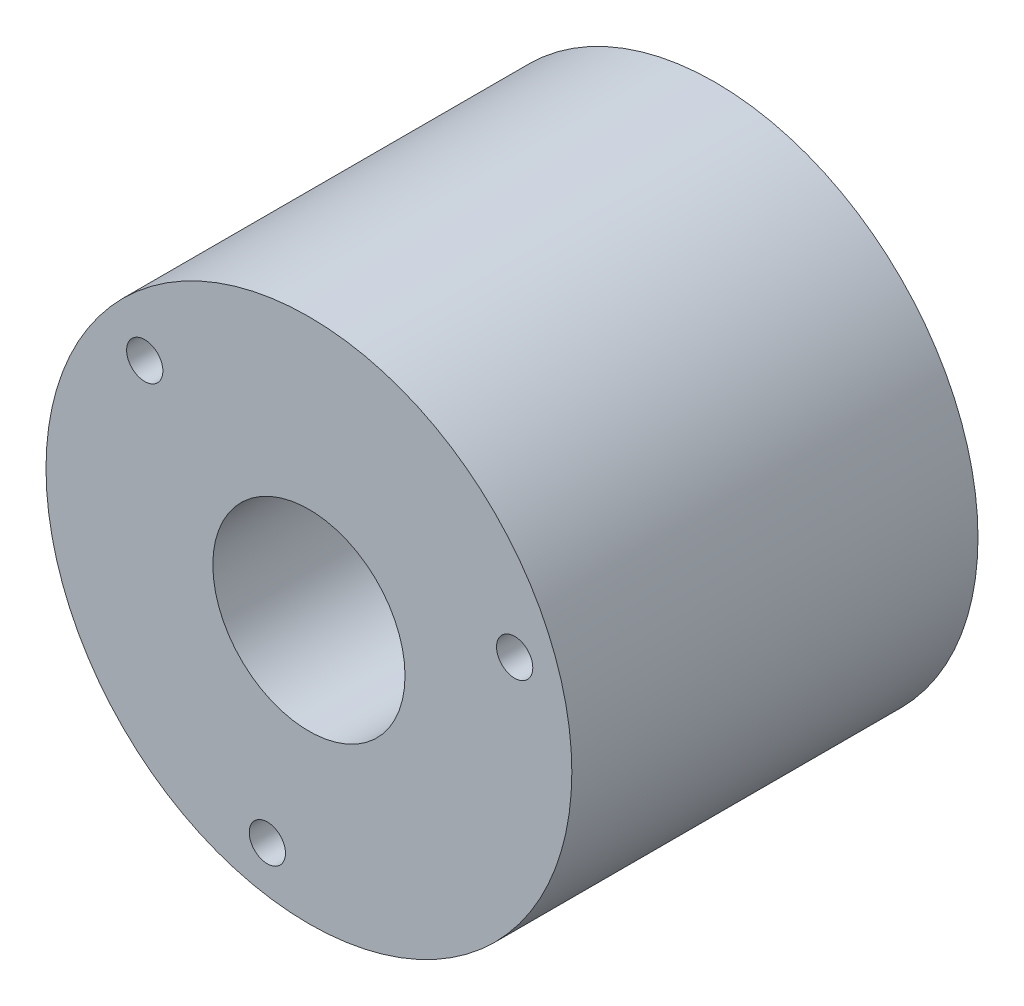
from build123d import *

# Parameters (mm, degrees)
SKETCH1_R                = 36.25
SKETCH1_R_2              = 13.25
BOSS_EXTRUDE1_DEPTH      = 48
BOSS_EXTRUDE3_DEPTH      = 8
BOSS_EXTRUDE3_DEPTH_BACK = 2.178622219
SKETCH2_R                = 36.25
SKETCH2_R_2              = 5.5
SKETCH3_R                = 2.5
CUT_EXTRUDE1_DEPTH       = 76.921834804


with BuildPart() as part:
    # Sketch1 → Boss-Extrude1 (new body)
    with BuildSketch(Plane.XY):
        Circle(SKETCH1_R)
        Circle(SKETCH1_R_2, mode=Mode.SUBTRACT)
    extrude(amount=BOSS_EXTRUDE1_DEPTH)

    # Sketch2 → Boss-Extrude3 (add, two sides: drawn at the far end of the back side and taken through both)
    with BuildSketch(Plane(origin=(0, 0, 0), x_dir=(-1, 0, 0), z_dir=(0, 0, -1)).offset(-BOSS_EXTRUDE3_DEPTH_BACK)):
        Circle(SKETCH2_R)
        Circle(SKETCH2_R_2, mode=Mode.SUBTRACT)
    extrude(amount=BOSS_EXTRUDE3_DEPTH + BOSS_EXTRUDE3_DEPTH_BACK)

    # Sketch3 → Cut-Extrude1 (cut, through all)
    with BuildSketch(Plane.XY.offset(48)):
        with Locations((-5.731515756, -29.447406119)):
            Circle(SKETCH3_R)
        with Locations((-22.636443897, 19.687341306)):
            Circle(SKETCH3_R)
        with Locations((28.367959653, 9.760064813)):
            Circle(SKETCH3_R)
    extrude(amount=-CUT_EXTRUDE1_DEPTH, mode=Mode.SUBTRACT)


solid = part.part
